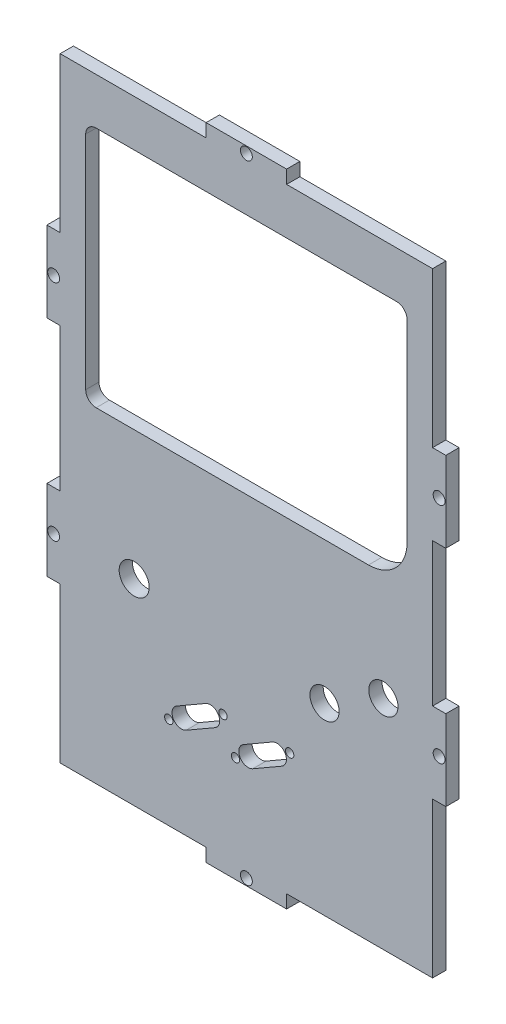
from build123d import *

# Parameters (mm, degrees)
SKETCH1_7_W             = 89.29
SKETCH1_7_H             = 147.294272306
SKETCH1_7_R             = 1
SKETCH1_7_R_2           = 3.6
SKETCH1_7_R_3           = 3.5
BODY_DEPTH              = 3.18
SKETCH2_W               = 19.3
SKETCH2_H               = 3.18
BOSS_EXTRUDE1_DEPTH     = 3.18
SKETCH3_R               = 1.425
CUT_EXTRUDE1_DEPTH      = 89.91398807
SKETCH4_W               = 3.18
SKETCH4_H               = 19.3
BOSS_EXTRUDE2_DEPTH     = 3.18
SKETCH5_R               = 1.425
CUT_EXTRUDE2_DEPTH      = 91.552481327
MIRROR2_COPY_1_SKETCH_W = 3.18
MIRROR2_COPY_1_SKETCH_H = 19.3
MIRROR2_COPY_1_DEPTH    = 3.18
MIRROR2_COPY_2_SKETCH_R = 1.425
MIRROR2_COPY_2_DEPTH    = 91.552481327
MIRROR2_COPY_3_SKETCH_W = 3.18
MIRROR2_COPY_3_SKETCH_H = 19.3
MIRROR2_COPY_3_DEPTH    = 3.18
MIRROR2_COPY_4_SKETCH_R = 1.425
MIRROR2_COPY_4_DEPTH    = 91.552481327


with BuildPart() as part:
    # Sketch1<7> → Body (new body)
    with BuildSketch(Plane.XY):
        Rectangle(SKETCH1_7_W, SKETCH1_7_H)
        with Locations((-18.606088913, -51.547136153)):
            Circle(SKETCH1_7_R, mode=Mode.SUBTRACT)
        with BuildLine():
            ThreePointArc((-14.45, -51.745693312), (-17.523557159, -50.922136153), (-16.7, -47.848578995))
            Line((-16.7, -47.848578995), (-9.77179677, -43.848578995))
            ThreePointArc((-9.77179677, -43.848578995), (-6.698239611, -44.672136153), (-7.52179677, -47.745693312))
            Line((-7.52179677, -47.745693312), (-14.45, -51.745693312))
        make_face(mode=Mode.SUBTRACT)
        with Locations((-2.606088913, -51.547136153)):
            Circle(SKETCH1_7_R, mode=Mode.SUBTRACT)
        with Locations((-5.615707856, -44.047136153)):
            Circle(SKETCH1_7_R, mode=Mode.SUBTRACT)
        with Locations((-26.900831216, -26.517202566)):
            Circle(SKETCH1_7_R_2, mode=Mode.SUBTRACT)
        with BuildLine():
            ThreePointArc((1.55, -51.745693312), (-1.523557159, -50.922136153), (-0.7, -47.848578995))
            Line((-0.7, -47.848578995), (6.22820323, -43.848578995))
            ThreePointArc((6.22820323, -43.848578995), (9.301760389, -44.672136153), (8.47820323, -47.745693312))
            Line((8.47820323, -47.745693312), (1.55, -51.745693312))
        make_face(mode=Mode.SUBTRACT)
        with Locations((10.384292144, -44.047136153)):
            Circle(SKETCH1_7_R, mode=Mode.SUBTRACT)
        with Locations((18.743927636, -29.544873515)):
            Circle(SKETCH1_7_R_3, mode=Mode.SUBTRACT)
        with Locations((32.854672368, -21.475291371)):
            Circle(SKETCH1_7_R_3, mode=Mode.SUBTRACT)
        with BuildLine():
            Line((-36.025, 62.507136153), (36.025, 62.507136153))
            ThreePointArc((36.025, 62.507136153), (37.792766953, 61.774903106), (38.525, 60.007136153))
            Line((38.525, 60.007136153), (38.525, 13.684445321))
            ThreePointArc((38.525, 13.684445321), (35.815737726, 7.143707595), (29.275, 4.434445321))
            Line((29.275, 4.434445321), (-36.025, 4.434445321))
            ThreePointArc((-36.025, 4.434445321), (-37.792766953, 5.166678368), (-38.525, 6.934445321))
            Line((-38.525, 6.934445321), (-38.525, 60.007136153))
            ThreePointArc((-38.525, 60.007136153), (-37.792766953, 61.774903106), (-36.025, 62.507136153))
        make_face(mode=Mode.SUBTRACT)
    extrude(amount=BODY_DEPTH)

    # Sketch2 → Boss-Extrude1 (add)
    with BuildSketch(Plane(origin=(0, 73.647136153, 0), x_dir=(1, 0, 0), z_dir=(0, 1, 0))):
        with Locations((0, -1.59)):
            Rectangle(SKETCH2_W, SKETCH2_H)
    boss_extrude1 = extrude(amount=BOSS_EXTRUDE1_DEPTH)

    # Sketch3 → Cut-Extrude1 (cut, through all)
    with BuildSketch(Plane.XY.offset(3.18)):
        with Locations((0, 75.237136153)):
            Circle(SKETCH3_R)
    cut_extrude1 = extrude(amount=-CUT_EXTRUDE1_DEPTH, mode=Mode.SUBTRACT)

    # Sketch4 → Boss-Extrude2 (add)
    with BuildSketch(Plane.ZY.offset(44.645)):
        with Locations((1.59, 26.827136153)):
            Rectangle(SKETCH4_W, SKETCH4_H)
    boss_extrude2 = extrude(amount=BOSS_EXTRUDE2_DEPTH)

    # Sketch5 → Cut-Extrude2 (cut, through all)
    with BuildSketch(Plane.XY.offset(3.18)):
        with Locations((-46.214145197, 26.827136153)):
            Circle(SKETCH5_R)
    cut_extrude2 = extrude(amount=-CUT_EXTRUDE2_DEPTH, mode=Mode.SUBTRACT)

    # Mirror1: Boss-Extrude2, Cut-Extrude2 across plane
    add(boss_extrude2.mirror(Plane(origin=(0, 0, 0), x_dir=(0, 0, 1), z_dir=(1, 0, 0))))
    add(cut_extrude2.mirror(Plane(origin=(0, 0, 0), x_dir=(0, 0, 1), z_dir=(1, 0, 0))), mode=Mode.SUBTRACT)

    # Mirror2: Boss-Extrude1, Cut-Extrude1 across plane
    add(boss_extrude1.mirror(Plane.ZX))
    add(cut_extrude1.mirror(Plane.ZX), mode=Mode.SUBTRACT)

    # Mirror2 copy 1 sketch → Mirror2 copy 1 (add)
    with BuildSketch(Plane(origin=(44.645, 0, 0), x_dir=(0, 0, 1), z_dir=(1, 0, 0))):
        with Locations((1.59, 26.827136153)):
            Rectangle(MIRROR2_COPY_1_SKETCH_W, MIRROR2_COPY_1_SKETCH_H)
    extrude(amount=MIRROR2_COPY_1_DEPTH)

    # Mirror2 copy 2 sketch → Mirror2 copy 2 (cut, through all)
    with BuildSketch(Plane(origin=(0, 0, 3.18), x_dir=(-1, 0, 0), z_dir=(0, 0, 1))):
        with Locations((-46.214145197, 26.827136153)):
            Circle(MIRROR2_COPY_2_SKETCH_R)
    extrude(amount=-MIRROR2_COPY_2_DEPTH, mode=Mode.SUBTRACT)

    # Mirror2 copy 3 sketch → Mirror2 copy 3 (add)
    with BuildSketch(Plane.ZY.offset(44.645)):
        with Locations((1.59, -26.827136153)):
            Rectangle(MIRROR2_COPY_3_SKETCH_W, MIRROR2_COPY_3_SKETCH_H)
    extrude(amount=MIRROR2_COPY_3_DEPTH)

    # Mirror2 copy 4 sketch → Mirror2 copy 4 (cut, through all)
    with BuildSketch(Plane.XY.offset(3.18)):
        with Locations((-46.214145197, -26.827136153)):
            Circle(MIRROR2_COPY_4_SKETCH_R)
    extrude(amount=-MIRROR2_COPY_4_DEPTH, mode=Mode.SUBTRACT)


solid = part.part
